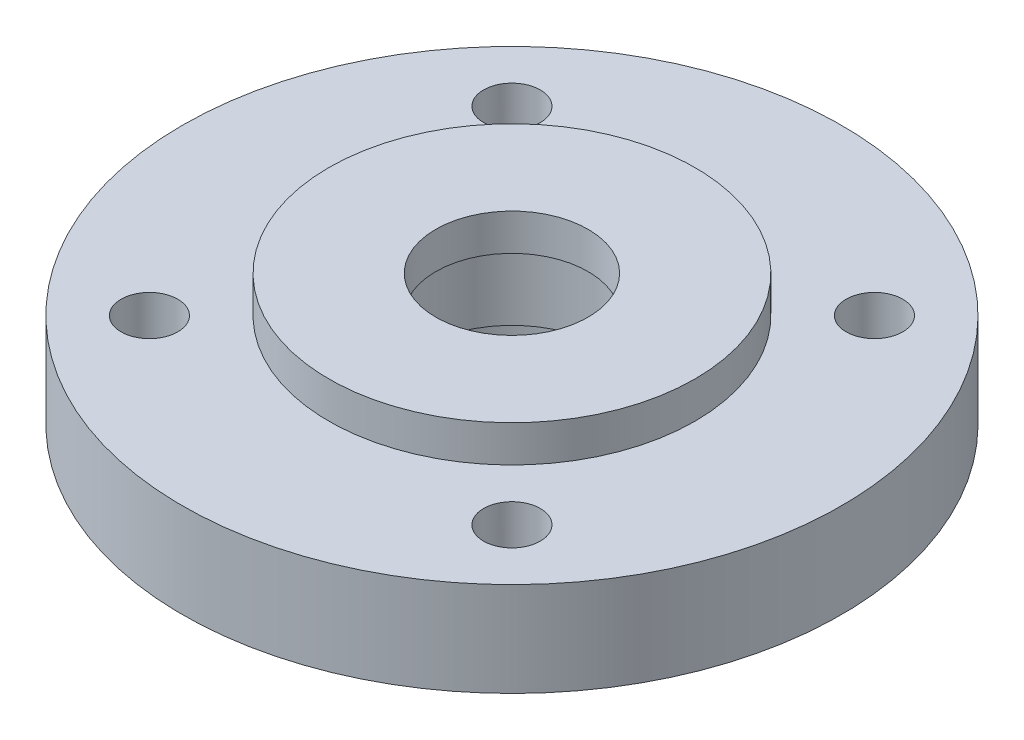
from build123d import *

# Parameters (mm, degrees)
F_10_0_1935_DIAMETER_HOLE1_D = 4.9149


with BuildPart() as part:
    # Sketch1 → Revolve1 (revolve)
    with BuildSketch(Plane.XY):
        Polygon((-15.875, -62.480244929), (-6.604, -62.480244929), (-6.604, -65.655244929), (-7.9375, -65.655244929), (-7.9375, -72.005244929), (-9.5, -72.005244929), (-9.5, -77.005244929), (-14.1605, -77.005244929), (-14.1605, -73.830244929), (-14.1605, -70.693344929), (-19.05, -70.693344929), (-19.05, -73.830244929), (-28.575, -73.830244929), (-28.575, -65.655244929), (-15.875, -65.655244929), align=None)
    revolve(axis=Axis((0, 0, 0), (0, -1, 0)))

    # #10 (0.1935) Diameter Hole1 (through all)
    with Locations(Plane(origin=(0, -62.480244929, 0), x_dir=(1, 0, 0), z_dir=(0, 1, 0))):
        with Locations((15.715448212, 15.715448212), (-15.715448212, 15.715448212), (-15.715448212, -15.715448212), (15.715448212, -15.715448212)):
            Hole(F_10_0_1935_DIAMETER_HOLE1_D / 2)


solid = part.part
